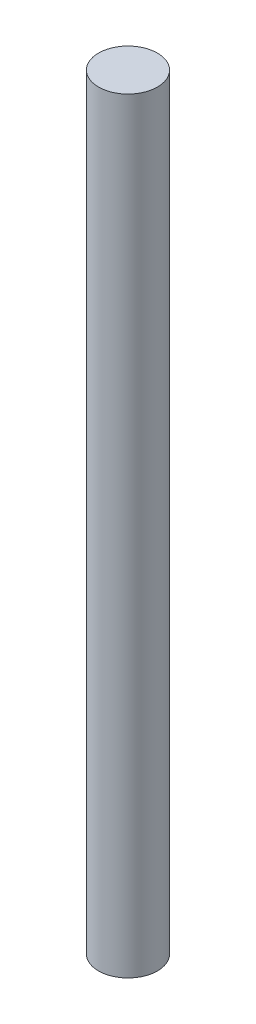
from build123d import *

# Parameters (mm, degrees)
SKETCH_1_R      = 2.5
EXTRUDE_1_DEPTH = 65


with BuildPart() as part:
    # 草图1 → 凸台-拉伸1 (new body)
    with BuildSketch(Plane(origin=(0, 0, 0), x_dir=(1, 0, 0), z_dir=(0, 1, 0))):
        Circle(SKETCH_1_R)
    extrude(amount=EXTRUDE_1_DEPTH)


solid = part.part
